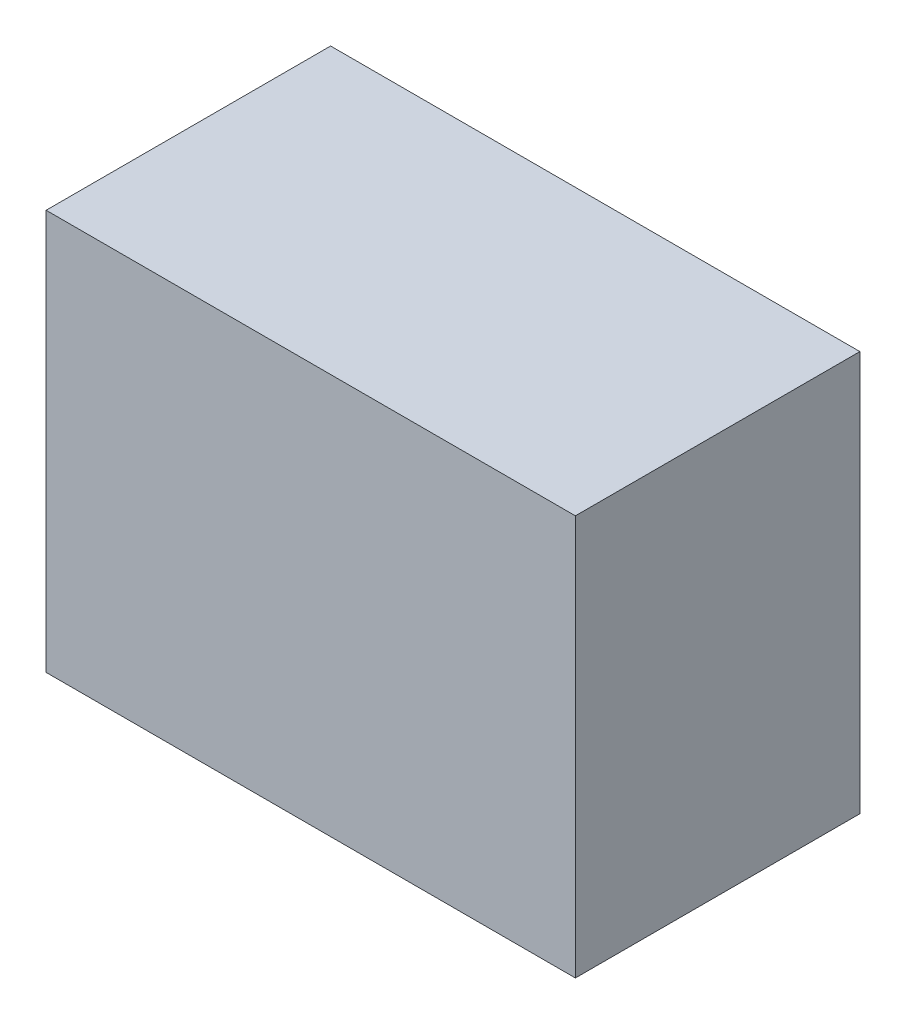
from build123d import *

# Parameters (mm, degrees)
SKETCH1_W           = 320
SKETCH1_H           = 172
BOSS_EXTRUDE1_DEPTH = 242


with BuildPart() as part:
    # Sketch1 → Boss-Extrude1 (new body)
    with BuildSketch(Plane(origin=(0, 0, 0), x_dir=(1, 0, 0), z_dir=(0, 1, 0))):
        Rectangle(SKETCH1_W, SKETCH1_H)
    extrude(amount=BOSS_EXTRUDE1_DEPTH)


solid = part.part
